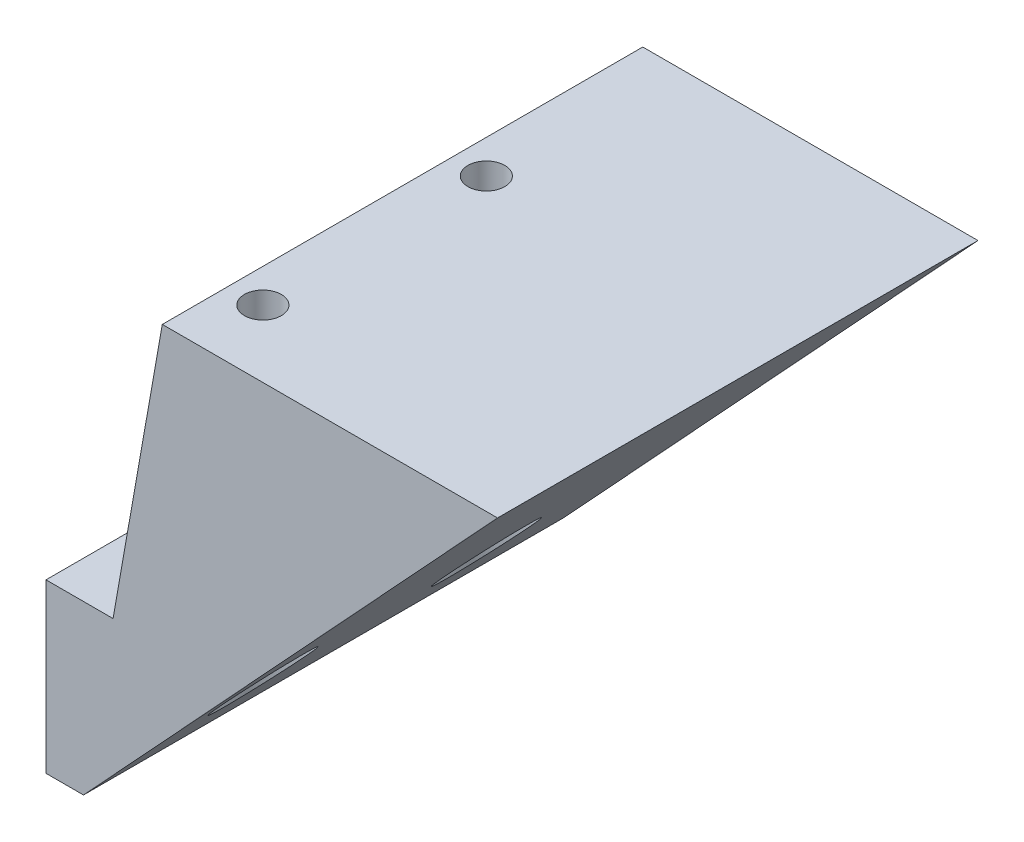
from build123d import *

# Parameters (mm, degrees)
EXTRUDE_1_DEPTH     = 43
SKETCH_2_R          = 1.65
CUT_EXTRUDE_1_DEPTH = 40
EXTRUDE_2_DEPTH     = 43
SKETCH_4_R          = 3.5
CUT_EXTRUDE_2_DEPTH = 15


with BuildPart() as part:
    # 草图1 → 凸台-拉伸1 (new body)
    with BuildSketch(Plane.XY):
        Polygon((0, 0), (7.053079228, 40), (37.053079228, 40), align=None)
    extrude(amount=EXTRUDE_1_DEPTH)

    # 草图2 → 切除-拉伸1 (cut)
    with BuildSketch(Plane(origin=(0, 40, 0), x_dir=(1, 0, 0), z_dir=(0, 1, 0))):
        with Locations((10.053079228, -17)):
            Circle(SKETCH_2_R)
        with Locations((10.053079228, -37)):
            Circle(SKETCH_2_R)
    extrude(amount=-CUT_EXTRUDE_1_DEPTH, mode=Mode.SUBTRACT)

    # 草图3 → 凸台-拉伸2 (add)
    with BuildSketch(Plane.XY.offset(43)):
        Polygon((2.644904711, 15), (-3.355095289, 15), (-3.355095289, 0), (0, 0), align=None)
    extrude(amount=-EXTRUDE_2_DEPTH)

    # 草图4 → 切除-拉伸2 (cut)
    with BuildSketch(Plane.XZ):
        with Locations((10.053079228, 37)):
            Circle(SKETCH_4_R)
        with Locations((10.053079228, 17)):
            Circle(SKETCH_4_R)
    extrude(amount=-CUT_EXTRUDE_2_DEPTH, mode=Mode.SUBTRACT)


solid = part.part
